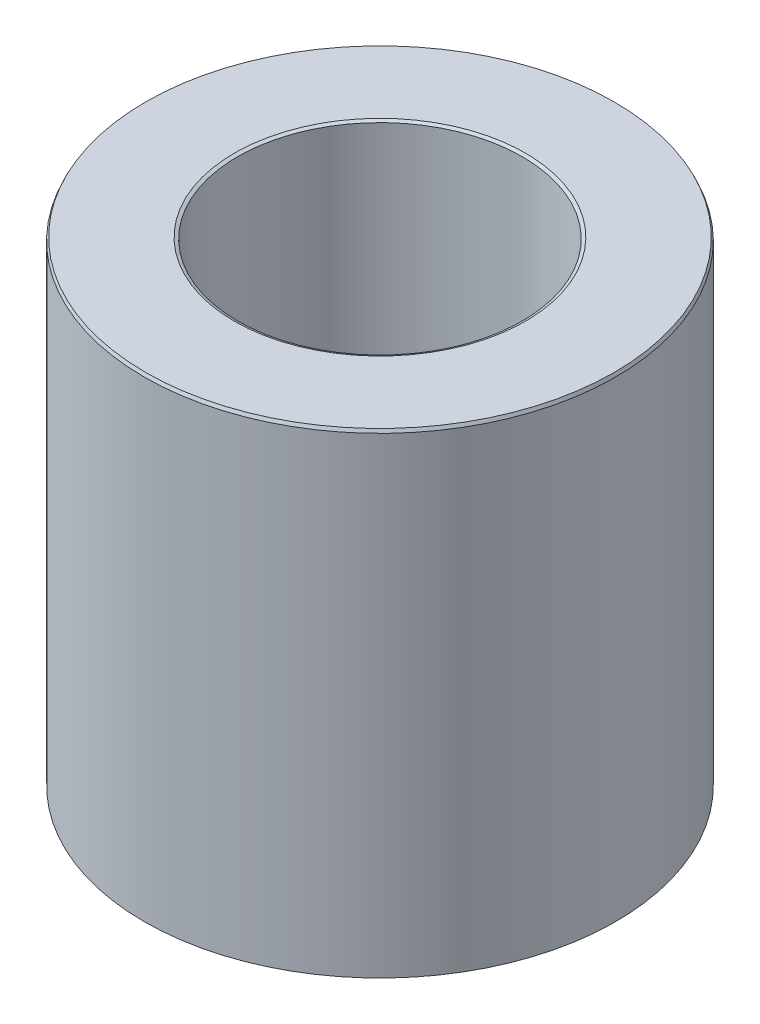
from build123d import *
from OCP.BRepFilletAPI import BRepFilletAPI_MakeChamfer

# Parameters (mm, degrees)
SKETCH1_R           = 60
BOSS_EXTRUDE1_DEPTH = 121.251599999
SKETCH2_R           = 36.232702936
CUT_EXTRUDE1_DEPTH  = 148.99307586
CHAMFER1_SIZE       = 0.823617782
CHAMFER1_SIZE2      = 0.363378662


with BuildPart() as part:
    # Sketch1 → Boss-Extrude1 (new body)
    with BuildSketch(Plane(origin=(0, 0, 0), x_dir=(1, 0, 0), z_dir=(0, 1, 0))):
        Circle(SKETCH1_R)
    extrude(amount=BOSS_EXTRUDE1_DEPTH)

    # Sketch2 → Cut-Extrude1 (cut, through all)
    with BuildSketch(Plane(origin=(0, 0, 0), x_dir=(1, 0, 0), z_dir=(0, 1, 0))):
        Circle(SKETCH2_R)
    extrude(amount=CUT_EXTRUDE1_DEPTH, mode=Mode.SUBTRACT)

    # Chamfer1: one chamfer whose edges measure the first distance from different faces: ONE call of the kernel's chamfer builder (chamfer() names one face for all edges)
    chamfer1_edges_1 = [part.edges().sort_by_distance(p)[0] for p in [
        (-36.232702936, 121.251599999, 0),
    ]]
    chamfer1_side_1 = [part.faces().sort_by_distance(p)[0] for p in [
        (-58.302943725, 121.251599999, 0),
    ]]
    chamfer1_edges_2 = [part.edges().sort_by_distance(p)[0] for p in [
        (-36.232702936, 0, 0),
    ]]
    chamfer1_side_2 = [part.faces().sort_by_distance(p)[0] for p in [
        (-36.232702936, 60.6258, 0),
    ]]
    chamfer1_edges_3 = [part.edges().sort_by_distance(p)[0] for p in [
        (-60, 0, 0),
    ]]
    chamfer1_side_3 = [part.faces().sort_by_distance(p)[0] for p in [
        (-58.302943725, 0, 0),
    ]]
    chamfer1_edges_4 = [part.edges().sort_by_distance(p)[0] for p in [
        (-60, 121.251599999, 0),
    ]]
    chamfer1_side_4 = [part.faces().sort_by_distance(p)[0] for p in [
        (-60, 60.6258, 0),
    ]]
    chamfer1 = BRepFilletAPI_MakeChamfer(part.part.solid().wrapped)
    for e in chamfer1_edges_1:
        chamfer1.Add(CHAMFER1_SIZE, CHAMFER1_SIZE2, e.wrapped, chamfer1_side_1[0].wrapped)  # the first distance lies on this face
    for e in chamfer1_edges_2:
        chamfer1.Add(CHAMFER1_SIZE, CHAMFER1_SIZE2, e.wrapped, chamfer1_side_2[0].wrapped)  # the first distance lies on this face
    for e in chamfer1_edges_3:
        chamfer1.Add(CHAMFER1_SIZE, CHAMFER1_SIZE2, e.wrapped, chamfer1_side_3[0].wrapped)  # the first distance lies on this face
    for e in chamfer1_edges_4:
        chamfer1.Add(CHAMFER1_SIZE, CHAMFER1_SIZE2, e.wrapped, chamfer1_side_4[0].wrapped)  # the first distance lies on this face
    add(Compound.cast(chamfer1.Shape()), mode=Mode.REPLACE)


solid = part.part
